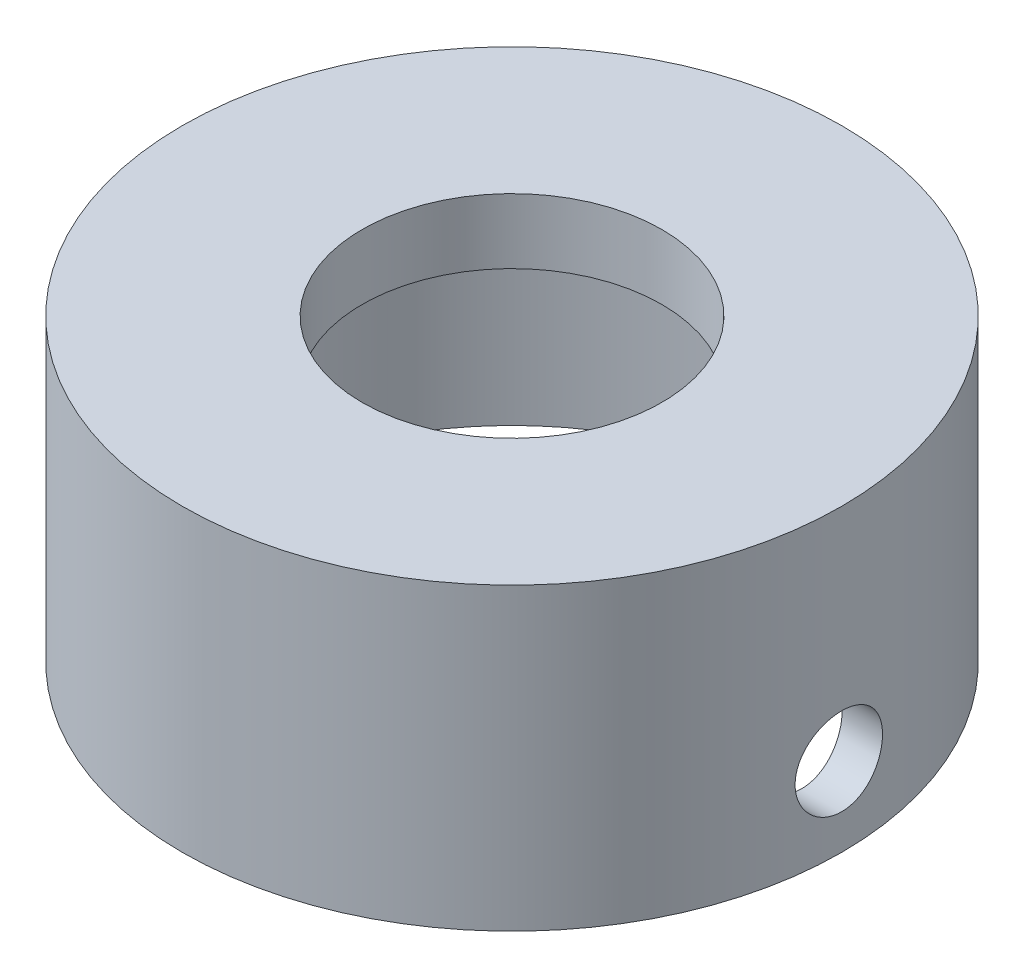
from build123d import *

# Parameters (mm, degrees)
SKETCH1_R               = 20.955
BOSS_EXTRUDE1_DEPTH     = 19.05
SKETCH2_R               = 18.415
CUT_EXTRUDE1_DEPTH      = 13.3985
SKETCH3_R               = 9.525
CUT_EXTRUDE2_DEPTH      = 36.229626027
SKETCH4_R               = 15.875
CUT_EXTRUDE3_DEPTH      = 1.524
CUT_EXTRUDE4_DEPTH      = 36.229626027
CUT_EXTRUDE4_DEPTH_BACK = 36.229626027
SKETCH5_R               = 2.778125


with BuildPart() as part:
    # Sketch1 → Boss-Extrude1 (new body)
    with BuildSketch(Plane(origin=(0, 0, 0), x_dir=(1, 0, 0), z_dir=(0, 1, 0))):
        Circle(SKETCH1_R)
    extrude(amount=-BOSS_EXTRUDE1_DEPTH)

    # Sketch2 → Cut-Extrude1 (cut)
    with BuildSketch(Plane.XZ.offset(19.05)):
        Circle(SKETCH2_R)
    extrude(amount=-CUT_EXTRUDE1_DEPTH, mode=Mode.SUBTRACT)

    # Sketch3 → Cut-Extrude2 (cut, through all)
    with BuildSketch(Plane(origin=(0, 0, 0), x_dir=(1, 0, 0), z_dir=(0, 1, 0))):
        Circle(SKETCH3_R)
    extrude(amount=-CUT_EXTRUDE2_DEPTH, mode=Mode.SUBTRACT)

    # Sketch4 → Cut-Extrude3 (cut)
    with BuildSketch(Plane.XZ.offset(5.6515)):
        Circle(SKETCH4_R)
    extrude(amount=-CUT_EXTRUDE3_DEPTH, mode=Mode.SUBTRACT)

    # Sketch5 → Cut-Extrude4 (cut, two sides: drawn at the far end of the back side and taken through both)
    with BuildSketch(Plane(origin=(0, 0, 0), x_dir=(0, 0, -1), z_dir=(1, 0, 0)).offset(-CUT_EXTRUDE4_DEPTH_BACK)):
        with Locations((0, -14.0335)):
            Circle(SKETCH5_R)
    extrude(amount=CUT_EXTRUDE4_DEPTH + CUT_EXTRUDE4_DEPTH_BACK, mode=Mode.SUBTRACT)


solid = part.part
